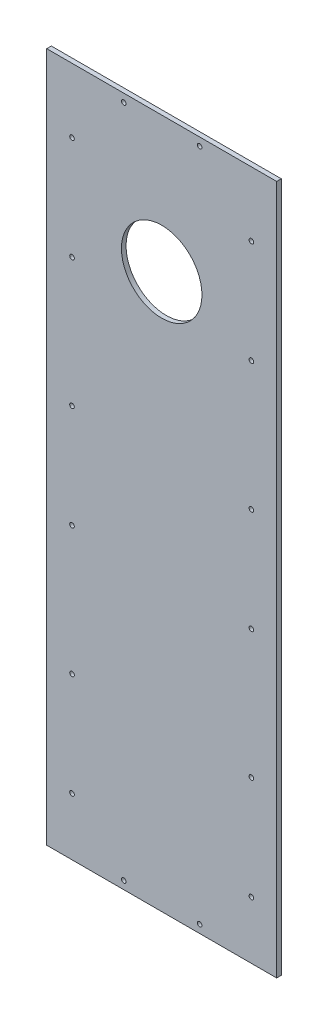
from build123d import *

# Parameters (mm, degrees)
SKETCH1_W           = 100
SKETCH1_H           = 300
BOSS_EXTRUDE1_DEPTH = 2
SKETCH2_R           = 1
CUT_EXTRUDE1_DEPTH  = 10
SKETCH3_R           = 17.5
CUT_EXTRUDE2_DEPTH  = 10


with BuildPart() as part:
    # Sketch1 → Boss-Extrude1 (new body)
    with BuildSketch(Plane.XY):
        Rectangle(SKETCH1_W, SKETCH1_H)
    extrude(amount=BOSS_EXTRUDE1_DEPTH)

    # Sketch2 → Cut-Extrude1 (cut)
    with BuildSketch(Plane.XY.offset(2)):
        with Locations((-39, 122)):
            Circle(SKETCH2_R)
        with Locations((-39, 77)):
            Circle(SKETCH2_R)
        with Locations((39, 122)):
            Circle(SKETCH2_R)
        with Locations((39, 77)):
            Circle(SKETCH2_R)
        with Locations((-39, 21)):
            Circle(SKETCH2_R)
        with Locations((-39, -24)):
            Circle(SKETCH2_R)
        with Locations((39, 21)):
            Circle(SKETCH2_R)
        with Locations((39, -24)):
            Circle(SKETCH2_R)
        with Locations((-39, -80)):
            Circle(SKETCH2_R)
        with Locations((-39, -125)):
            Circle(SKETCH2_R)
        with Locations((39, -80)):
            Circle(SKETCH2_R)
        with Locations((39, -125)):
            Circle(SKETCH2_R)
        with Locations((16.5, -146.5)):
            Circle(SKETCH2_R)
        with Locations((-16.5, -146.5)):
            Circle(SKETCH2_R)
        with Locations((-16.5, 146.5)):
            Circle(SKETCH2_R)
        with Locations((16.5, 146.5)):
            Circle(SKETCH2_R)
    extrude(amount=-CUT_EXTRUDE1_DEPTH, mode=Mode.SUBTRACT)

    # Sketch3 → Cut-Extrude2 (cut)
    with BuildSketch(Plane(origin=(0, 0, 0), x_dir=(-1, 0, 0), z_dir=(0, 0, -1))):
        with Locations((0, 91)):
            Circle(SKETCH3_R)
    extrude(amount=-CUT_EXTRUDE2_DEPTH, mode=Mode.SUBTRACT)


solid = part.part
